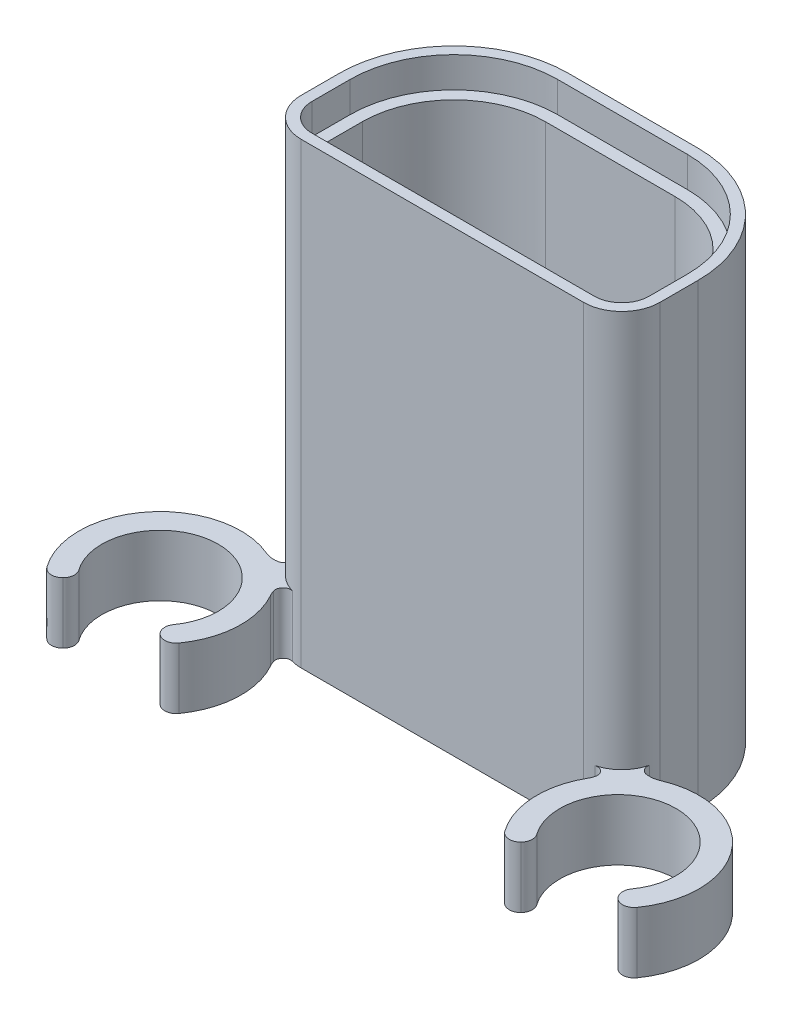
from build123d import *

# Parameters (mm, degrees)
SKETCH1_W               = 47
SKETCH1_H               = 25
BOSS_EXTRUDE1_DEPTH     = 60
SHELL1_T                = -3
FILLET2_R               = 12
FILLET3_R               = 15
SKETCH5_R               = 7.624999999999999
BOSS_EXTRUDE3_DEPTH     = 8
FILLET7_R               = 2
FILLET8_R               = 5
FILLET9_R               = 3
FILLET10_R              = 3
FILLET11_R              = 1
CUT_EXTRUDE5_DEPTH      = 4
CUT_EXTRUDE6_DEPTH      = 70
CUT_EXTRUDE6_DEPTH_BACK = 1
SKETCH8_R               = 5.499999999999999
CUT_EXTRUDE7_DEPTH      = 0.5
BOSS_EXTRUDE4_DEPTH     = 0.5
CIRPATTERN1_COUNT       = 18
SKETCH11_R              = 7.086373105198711
SKETCH11_R_2            = 6.555925452129436
BOSS_EXTRUDE5_DEPTH     = 0.5
FILLET12_R              = 0.5
CUT_EXTRUDE8_DEPTH      = 10
FILLET13_R              = 1.5


# Some blends are built 0.0001 mm under size
with BuildPart() as part:
    # Sketch1 → Boss-Extrude1 (new body)
    with BuildSketch(Plane(origin=(0, 0, 0), x_dir=(1, 0, 0), z_dir=(0, 1, 0))):
        Rectangle(SKETCH1_W, SKETCH1_H)
    extrude(amount=BOSS_EXTRUDE1_DEPTH)

    # Shell1
    shell1_openings = [part.faces().sort_by_distance(p)[0] for p in [
        (0, 60, 0),
    ]]
    offset(amount=SHELL1_T, openings=shell1_openings, kind=Kind.INTERSECTION)

    # Fillet2
    fillet2_edges = [part.edges().sort_by_distance(p)[0] for p in [
        (-20.500000000000007, 31.5, -9.499999999999996),
        (20.499999999999993, 31.5, -9.499999999999996),
    ]]
    fillet(fillet2_edges, radius=FILLET2_R)

    # Fillet3
    fillet3_edges = [part.edges().sort_by_distance(p)[0] for p in [
        (-23.500000000000007, 30, -12.499999999999996),
        (23.499999999999993, 30, -12.499999999999996),
    ]]
    fillet(fillet3_edges, radius=FILLET3_R)

    # Sketch5 → Boss-Extrude3 (add)
    # profile 1 of 2: a face of its own
    with BuildSketch(Plane(origin=(0, 0, 0), x_dir=(1, 0, 0), z_dir=(0, 1, 0))):
        with BuildLine():
            Line((-24.109061311975577, -10.657632309503462), (-23.023781021816077, -9.500000000000002))
            Line((-23.023781021816077, -9.500000000000002), (-18.81711504197636, -9.500000000000002))
            Line((-18.81711504197636, -9.500000000000002), (-21.851077989353325, -12.681958120955978))
            ThreePointArc((-21.851077989353325, -12.681958120955978), (-37.092523941253255, -27.41117748143407), (-24.109061311975577, -10.657632309503462))
        make_face()
        with Locations(Location((-30, -19.500000000000004, 0), (0, 0, 270))):
            Circle(SKETCH5_R, mode=Mode.SUBTRACT)
    # profile 2 of 2: a face of its own
    with BuildSketch(Plane(origin=(0, 0, 0), x_dir=(1, 0, 0), z_dir=(0, 1, 0))):
        with BuildLine():
            Line((21.851077989353325, -12.681958120955972), (18.81711504197636, -9.499999999999996))
            Line((18.81711504197636, -9.499999999999996), (23.023781021816077, -9.499999999999996))
            Line((23.023781021816077, -9.499999999999996), (24.109061311975577, -10.657632309503457))
            ThreePointArc((24.109061311975577, -10.657632309503457), (37.092523941253255, -27.411177481434063), (21.851077989353325, -12.681958120955972))
        make_face()
        with Locations(Location((30, -19.499999999999996, 0), (0, 0, 90))):
            Circle(SKETCH5_R, mode=Mode.SUBTRACT)
    extrude(amount=BOSS_EXTRUDE3_DEPTH)

    # Fillet7
    fillet7_edges = [part.edges().sort_by_distance(p)[0] for p in [
        (-20.500000000000007, 31.5, 9.5),
        (20.499999999999993, 31.5, 9.5),
    ]]
    fillet(fillet7_edges, radius=FILLET7_R)

    # Fillet8
    # the kernel refuses this fillet: 5 mm, written as the material it takes off along each edge
    with BuildSketch(Plane(origin=(-23.500000000000007, -4.499999999999998, 12.5), x_dir=(0, 0, -1), z_dir=(0, 1, 0))) as fillet8_piece_1_section:
        with BuildLine():
            CenterArc((FILLET8_R, -FILLET8_R), FILLET8_R, 90, 89.99999999999997)
            Line((0, -FILLET8_R), (0, 0))
            Line((0, 0), (FILLET8_R, 0))
        make_face()
    fillet8_piece_1 = extrude(amount=77, mode=Mode.PRIVATE)
    fillet8_piece_1 = split(fillet8_piece_1, bisect_by=Plane(origin=(-23.438804598936287, 8, 9.039032547374688), z_dir=(0, -1, 0)), keep=Keep.TOP, mode=Mode.PRIVATE)
    fillet8_piece_1 = split(fillet8_piece_1, bisect_by=Plane(origin=(-22.987914319574855, 1.7499999999999993, 9.461742184276032), z_dir=(-0.7295372041400837, 0, -0.6839411288813314)), keep=Keep.TOP, mode=Mode.PRIVATE)
    add(fillet8_piece_1, mode=Mode.SUBTRACT)
    with BuildSketch(Plane(origin=(-23.500000000000007, 8, 12.5), x_dir=(0, 0, -1), z_dir=(0, 1, 0))) as fillet8_piece_2_section:
        with BuildLine():
            CenterArc((FILLET8_R, -FILLET8_R), FILLET8_R, 90, 89.99999999999997)
            Line((0, -FILLET8_R), (0, 0))
            Line((0, 0), (FILLET8_R, 0))
        make_face()
    fillet8_piece_2 = extrude(amount=64.5, mode=Mode.PRIVATE)
    fillet8_piece_2 = split(fillet8_piece_2, bisect_by=Plane(origin=(-22.987914319574855, 40.25000000000001, 9.461742184276032), z_dir=(-0.7295372041400837, 0, -0.6839411288813314)), keep=Keep.TOP, mode=Mode.PRIVATE)
    add(fillet8_piece_2, mode=Mode.SUBTRACT)
    with BuildSketch(Plane(origin=(-23.500000000000007, -4.499999999999998, 12.5), x_dir=(0, 0, -1), z_dir=(0, 1, 0))) as fillet8_piece_3_section:
        with BuildLine():
            CenterArc((FILLET8_R, -FILLET8_R), FILLET8_R, 90, 89.99999999999997)
            Line((0, -FILLET8_R), (0, 0))
            Line((0, 0), (FILLET8_R, 0))
        make_face()
    fillet8_piece_3 = extrude(amount=77, mode=Mode.PRIVATE)
    fillet8_piece_3 = split(fillet8_piece_3, bisect_by=Plane(origin=(-20.487794777660064, 8, 12.365998214829558), z_dir=(0, -1, 0)), keep=Keep.TOP, mode=Mode.PRIVATE)
    fillet8_piece_3 = split(fillet8_piece_3, bisect_by=Plane(origin=(-21.044075525816314, 1.7500000000000062, 11.835590486603977), z_dir=(0.7237372179730626, 0, 0.6900756765171571)), keep=Keep.TOP, mode=Mode.PRIVATE)
    add(fillet8_piece_3, mode=Mode.SUBTRACT)
    with BuildSketch(Plane(origin=(-23.500000000000007, 8, 12.5), x_dir=(0, 0, -1), z_dir=(0, 1, 0))) as fillet8_piece_4_section:
        with BuildLine():
            CenterArc((FILLET8_R, -FILLET8_R), FILLET8_R, 90, 89.99999999999997)
            Line((0, -FILLET8_R), (0, 0))
            Line((0, 0), (FILLET8_R, 0))
        make_face()
    fillet8_piece_4 = extrude(amount=64.5, mode=Mode.PRIVATE)
    fillet8_piece_4 = split(fillet8_piece_4, bisect_by=Plane(origin=(-23.833277764377865, 40.2499999999999, 10.363463192065906), z_dir=(0.7295372041400837, 0, 0.6839411288813314)), keep=Keep.TOP, mode=Mode.PRIVATE)
    fillet8_piece_4 = split(fillet8_piece_4, bisect_by=Plane(origin=(-21.62776506078224, 40.2499999999999, 12.44775210100588), z_dir=(-0.7237372179730626, 0, -0.6900756765171571)), keep=Keep.TOP, mode=Mode.PRIVATE)
    add(fillet8_piece_4, mode=Mode.SUBTRACT)
    with BuildSketch(Plane(origin=(-23.500000000000007, 8, 12.5), x_dir=(0, 0, -1), z_dir=(0, 1, 0))) as fillet8_piece_5_section:
        with BuildLine():
            CenterArc((FILLET8_R, -FILLET8_R), FILLET8_R, 90, 89.99999999999997)
            Line((0, -FILLET8_R), (0, 0))
            Line((0, 0), (FILLET8_R, 0))
        make_face()
    fillet8_piece_5 = extrude(amount=64.5, mode=Mode.PRIVATE)
    fillet8_piece_5 = split(fillet8_piece_5, bisect_by=Plane(origin=(-21.044075525816314, 40.24999999999998, 11.835590486603977), z_dir=(0.7237372179730626, 0, 0.6900756765171571)), keep=Keep.TOP, mode=Mode.PRIVATE)
    add(fillet8_piece_5, mode=Mode.SUBTRACT)
    with BuildSketch(Plane(origin=(23.49999999999999, -4.5, 12.5), x_dir=(0, 0, -1), z_dir=(0, 1, 0))) as fillet8_piece_6_section:
        with BuildLine():
            CenterArc((FILLET8_R, FILLET8_R), FILLET8_R, 180, 90)
            Line((0, FILLET8_R), (0, 0))
            Line((0, 0), (FILLET8_R, 0))
        make_face()
    fillet8_piece_6 = extrude(amount=77, mode=Mode.PRIVATE)
    fillet8_piece_6 = split(fillet8_piece_6, bisect_by=Plane(origin=(22.98791431957484, 1.7500000000000275, 9.461742184276012), z_dir=(0.7295372041400837, 0, -0.6839411288813314)), keep=Keep.TOP, mode=Mode.PRIVATE)
    fillet8_piece_6 = split(fillet8_piece_6, bisect_by=Plane(origin=(23.43880459893627, 8, 9.03903254737467), z_dir=(0, -1, 0)), keep=Keep.TOP, mode=Mode.PRIVATE)
    add(fillet8_piece_6, mode=Mode.SUBTRACT)
    with BuildSketch(Plane(origin=(23.49999999999999, 8, 12.5), x_dir=(0, 0, -1), z_dir=(0, 1, 0))) as fillet8_piece_7_section:
        with BuildLine():
            CenterArc((FILLET8_R, FILLET8_R), FILLET8_R, 180, 90)
            Line((0, FILLET8_R), (0, 0))
            Line((0, 0), (FILLET8_R, 0))
        make_face()
    fillet8_piece_7 = extrude(amount=64.5, mode=Mode.PRIVATE)
    fillet8_piece_7 = split(fillet8_piece_7, bisect_by=Plane(origin=(22.987914319574845, 40.249999999999865, 9.461742184276018), z_dir=(0.7295372041400837, 0, -0.6839411288813314)), keep=Keep.TOP, mode=Mode.PRIVATE)
    add(fillet8_piece_7, mode=Mode.SUBTRACT)
    with BuildSketch(Plane(origin=(23.49999999999999, -4.5, 12.5), x_dir=(0, 0, -1), z_dir=(0, 1, 0))) as fillet8_piece_8_section:
        with BuildLine():
            CenterArc((FILLET8_R, FILLET8_R), FILLET8_R, 180, 90)
            Line((0, FILLET8_R), (0, 0))
            Line((0, 0), (FILLET8_R, 0))
        make_face()
    fillet8_piece_8 = extrude(amount=77, mode=Mode.PRIVATE)
    fillet8_piece_8 = split(fillet8_piece_8, bisect_by=Plane(origin=(20.487794777660056, 8, 12.365998214829556), z_dir=(0, -1, 0)), keep=Keep.TOP, mode=Mode.PRIVATE)
    fillet8_piece_8 = split(fillet8_piece_8, bisect_by=Plane(origin=(21.04407552581631, 1.7499999999999931, 11.835590486603968), z_dir=(-0.7237372179730626, 0, 0.6900756765171571)), keep=Keep.TOP, mode=Mode.PRIVATE)
    add(fillet8_piece_8, mode=Mode.SUBTRACT)
    with BuildSketch(Plane(origin=(23.49999999999999, 8, 12.5), x_dir=(0, 0, -1), z_dir=(0, 1, 0))) as fillet8_piece_9_section:
        with BuildLine():
            CenterArc((FILLET8_R, FILLET8_R), FILLET8_R, 180, 90)
            Line((0, FILLET8_R), (0, 0))
            Line((0, 0), (FILLET8_R, 0))
        make_face()
    fillet8_piece_9 = extrude(amount=64.5, mode=Mode.PRIVATE)
    fillet8_piece_9 = split(fillet8_piece_9, bisect_by=Plane(origin=(23.833277764377858, 40.250000000000014, 10.363463192065893), z_dir=(-0.7295372041400837, 0, 0.6839411288813314)), keep=Keep.TOP, mode=Mode.PRIVATE)
    fillet8_piece_9 = split(fillet8_piece_9, bisect_by=Plane(origin=(21.627765060782234, 40.250000000000014, 12.44775210100587), z_dir=(0.7237372179730626, 0, -0.6900756765171571)), keep=Keep.TOP, mode=Mode.PRIVATE)
    add(fillet8_piece_9, mode=Mode.SUBTRACT)
    with BuildSketch(Plane(origin=(23.49999999999999, 8, 12.5), x_dir=(0, 0, -1), z_dir=(0, 1, 0))) as fillet8_piece_10_section:
        with BuildLine():
            CenterArc((FILLET8_R, FILLET8_R), FILLET8_R, 180, 90)
            Line((0, FILLET8_R), (0, 0))
            Line((0, 0), (FILLET8_R, 0))
        make_face()
    fillet8_piece_10 = extrude(amount=64.5, mode=Mode.PRIVATE)
    fillet8_piece_10 = split(fillet8_piece_10, bisect_by=Plane(origin=(21.044075525816314, 40.250000000000036, 11.83559048660397), z_dir=(-0.7237372179730626, 0, 0.6900756765171571)), keep=Keep.TOP, mode=Mode.PRIVATE)
    add(fillet8_piece_10, mode=Mode.SUBTRACT)

    # Fillet9
    # the kernel refuses this fillet: 3 mm, written as the material it adds along each edge
    with BuildSketch(Plane(origin=(-24.10906131197558, 0, 10.657632309503459), x_dir=(0.6839411288812834, 0, -0.7295372041401286), z_dir=(0, 1, 0))) as fillet9_piece_1:
        with BuildLine():
            CenterArc((2.330398425193465, 2.8908079117401275), FILLET9_R, 199.9140279839993, 54.580009405858846)
            Line((-0.4902158613140944, 1.8689786467699698), (-0.5466281470442454, 1.848542061470567))
            ThreePointArc((-0.5466281470442454, 1.848542061470567), (-0.2605714309807761, 0.9304333898711258), (-0.05918056353521951, -0.00988235294117272))
            Line((-0.05918056353521951, -0.00988235294117272), (6.72e-15, -0.05999999999999864))
            ThreePointArc((6.72e-15, -0.05999999999999864), (0.7641912271959885, -0.06000000000008859), (1.5123421349759287, -0.05781615823480298))
            Line((1.5123421349759287, -0.05781615823480298), (1.528382454391958, 5e-17))
        make_face()
    extrude(amount=8)
    with BuildSketch(Plane(origin=(24.109061311975577, 0, 10.657632309503459), x_dir=(0.8791890960981853, 0, -0.4764730142432579), z_dir=(0, 1, 0))) as fillet9_piece_2:
        with BuildLine():
            CenterArc((2.204979975395922, 2.9875726787521892), FILLET9_R, 210.203051106146, 54.58000940585879)
            Line((-0.3877640665635849, 1.4783747683098676), (-0.43961894740277574, 1.4481908101010217))
            ThreePointArc((-0.43961894740277574, 1.4481908101010217), (-0.25191887206113933, 0.7239648566213424), (-0.0580368387792579, -0.01522252753356888))
            Line((-0.0580368387792579, -0.01522252753356888), (0.00545562055768073, -0.05975145357504427))
            ThreePointArc((0.00545562055768073, -0.05975145357504427), (0.9660994737559414, -0.01598657058067033), (1.9267433269542062, -0.05975145357504364))
            Line((1.9267433269542062, -0.05975145357504364), (1.9321989475118866, -4e-17))
        make_face()
    extrude(amount=8)

    # Fillet10
    # the kernel refuses this fillet: 3 mm, written as the material it adds along each edge
    with BuildSketch(Plane(origin=(-21.85107798935332, 0, 12.681958120955976), x_dir=(0.5712001506063948, 0, 0.8208108113001631), z_dir=(0, 1, 0))) as fillet10_piece_1:
        with BuildLine():
            CenterArc((2.149193638263051, 2.98819477692178), FILLET10_R, 217.23553231937467, 47.67986970857078)
            Line((-0.23927081913074655, 1.172915862879494), (-0.2870401082786234, 1.136610284598648))
            ThreePointArc((-0.2870401082786234, 1.136610284598648), (-0.17842463259395833, 0.5744651312779336), (-0.05878922302837329, -0.0119928001617703))
            Line((-0.05878922302837329, -0.0119928001617703), (0.00531759250704288, -0.05976389553843487))
            ThreePointArc((0.00531759250704288, -0.05976389553843487), (0.9416570064554589, -0.01818983493130785), (1.8779964204038802, -0.05976389553843735))
            Line((1.8779964204038802, -0.05976389553843735), (1.8833140129109234, -1e-16))
        make_face()
    extrude(amount=8)
    with BuildSketch(Plane(origin=(21.85107798935332, 0, 12.681958120955974), x_dir=(-0.6900756765174183, 0, -0.7237372179728133), z_dir=(0, 1, 0))) as fillet10_piece_2:
        with BuildLine():
            CenterArc((2.4983133230015917, 2.7031041155837388), FILLET10_R, 196.6145399789958, 47.67986970857072)
            Line((-0.376436809977725, 1.8453094589581573), (-0.43393181263731273, 1.8281535658256447))
            ThreePointArc((-0.43393181263731273, 1.8281535658256447), (-0.20604117603262675, 0.9190189452239744), (-0.05962076346887163, -0.00673532207015936))
            Line((-0.05962076346887163, -0.00673532207015936), (-2.607e-14, -0.05999999999999991))
            ThreePointArc((-2.607e-14, -0.05999999999999991), (0.598536161455952, -0.05999999999993272), (1.1710475029101708, -0.05406208231167564))
            Line((1.1710475029101708, -0.05406208231167564), (1.197072322911963, 2e-17))
        make_face()
    extrude(amount=8)

    # Fillet11
    fillet11_edges = [part.edges().sort_by_distance(p)[0] for p in [
        (-21.025007496279773, 4, 11.815592328259351),
        (-23.0637376907564, 4, 9.542620446869517),
        (23.0637376907564, 4, 9.542620446869517),
        (21.025007496279773, 4, 11.815592328259351),
    ]]
    fillet(fillet11_edges, radius=FILLET11_R)

    # Sketch6 → Cut-Extrude5 (cut)
    with BuildSketch(Plane(origin=(0, 60, 0), x_dir=(1, 0, 0), z_dir=(0, 1, 0))):
        with BuildLine():
            Line((22.09999999999999, -7.500000000000001), (22.099999999999994, -2.5000000000000004))
            ThreePointArc((22.099999999999994, -2.5000000000000004), (18.11665222413704, 7.116652224137045), (8.499999999999993, 11.099999999999998))
            Line((8.499999999999993, 11.099999999999998), (-8.500000000000007, 11.099999999999998))
            ThreePointArc((-8.500000000000007, 11.099999999999998), (-18.116652224137056, 7.116652224137045), (-22.10000000000001, -2.500000000000001))
            Line((-22.10000000000001, -2.500000000000001), (-22.10000000000001, -7.500000000000002))
            ThreePointArc((-22.10000000000001, -7.500000000000002), (-21.04558441227158, -10.045584412271571), (-18.50000000000001, -11.1))
            Line((-18.50000000000001, -11.1), (18.49999999999999, -11.100000000000001))
            ThreePointArc((18.49999999999999, -11.100000000000001), (21.04558441227156, -10.045584412271573), (22.09999999999999, -7.500000000000001))
        make_face()
    extrude(amount=-CUT_EXTRUDE5_DEPTH, mode=Mode.SUBTRACT)

    # Sketch7 → Cut-Extrude6 (cut, two sides: drawn at the far end of the back side and taken through both)
    with BuildSketch(Plane(origin=(0, 3, 0), x_dir=(1, 0, 0), z_dir=(0, 1, 0)).offset(-CUT_EXTRUDE6_DEPTH_BACK)):
        with BuildLine():
            Line((-20.500000000000007, -8.000000000000002), (20.49999999999999, -8.000000000000002))
            Line((20.49999999999999, -8.000000000000002), (20.49999999999999, -3.0000000000000018))
            Line((20.49999999999999, -3.0000000000000018), (15.500000000000005, -3.0000000000000018))
            ThreePointArc((15.500000000000005, -3.0000000000000018), (14.085786437626895, -2.4142135623730967), (13.499999999999991, -0.9999999999999875))
            Line((13.499999999999991, -0.9999999999999875), (13.499999999999991, 4.999999999999984))
            ThreePointArc((13.499999999999991, 4.999999999999984), (12.914213562373087, 6.414213562373093), (11.499999999999977, 6.999999999999998))
            Line((11.499999999999977, 6.999999999999998), (-11.499999999999995, 6.999999999999998))
            ThreePointArc((-11.499999999999995, 6.999999999999998), (-12.914213562373105, 6.414213562373093), (-13.500000000000009, 4.999999999999984))
            Line((-13.500000000000009, 4.999999999999984), (-13.500000000000009, -0.9999999999999875))
            ThreePointArc((-13.500000000000009, -0.9999999999999875), (-14.085786437626913, -2.4142135623730967), (-15.500000000000023, -3.0000000000000018))
            Line((-15.500000000000023, -3.0000000000000018), (-20.500000000000007, -3.0000000000000018))
            Line((-20.500000000000007, -3.0000000000000018), (-20.500000000000007, -8.000000000000002))
        make_face()
    extrude(amount=CUT_EXTRUDE6_DEPTH + CUT_EXTRUDE6_DEPTH_BACK, mode=Mode.SUBTRACT)

    # Sketch8 → Cut-Extrude7 (cut)
    with BuildSketch(Plane(origin=(0, 0, -12.499999999999996), x_dir=(-1, 0, 0), z_dir=(0, 0, -1))):
        with BuildLine():
            Line((-6.999999999999999, 24), (7.000000000000003, 24))
            ThreePointArc((7.000000000000003, 24), (9.121320343559645, 24.878679656440358), (10.000000000000002, 27))
            Line((10.000000000000002, 27), (10.000000000000002, 41))
            ThreePointArc((10.000000000000002, 41), (9.121320343559649, 43.121320343559645), (7.000000000000002, 44.00000000000001))
            Line((7.000000000000002, 44.00000000000001), (-6.999999999999999, 44.00000000000001))
            ThreePointArc((-6.999999999999999, 44.00000000000001), (-9.121320343559642, 43.121320343559645), (-9.999999999999998, 41))
            Line((-9.999999999999998, 41), (-9.999999999999996, 27))
            ThreePointArc((-9.999999999999996, 27), (-9.121320343559642, 24.878679656440358), (-6.999999999999999, 24))
        make_face()
        with Locations((0, 34)):
            Circle(SKETCH8_R, mode=Mode.SUBTRACT)
    extrude(amount=-CUT_EXTRUDE7_DEPTH, mode=Mode.SUBTRACT)

    # Sketch10 → Boss-Extrude4 (add)
    with BuildSketch(Plane(origin=(0, 0, -11.999999999999996), x_dir=(-1, 0, 0), z_dir=(0, 0, -1))):
        with BuildLine():
            Line((0.5710432913647049, 42.130448263961284), (-0.5710432913647049, 42.130448263961284))
            Line((-0.5710432913647049, 42.130448263961284), (-0.8629869867694857, 40.64418945099148))
            ThreePointArc((-0.8629869867694857, 40.64418945099148), (4.1e-16, 40.699999999999996), (0.8629869867694857, 40.64418945099148))
            Line((0.8629869867694857, 40.64418945099148), (0.5710432913647049, 42.130448263961284))
        make_face()
    boss_extrude4 = extrude(amount=BOSS_EXTRUDE4_DEPTH)

    # CirPattern1: Boss-Extrude4 ×18 about axis
    cirpattern1_axis = Axis((9.3e-15, 34.000000000000014, 0), (0, 0, 1))
    for i in range(1, CIRPATTERN1_COUNT):
        add(boss_extrude4.rotate(cirpattern1_axis, i * 360 / CIRPATTERN1_COUNT))

    # Sketch11 → Boss-Extrude5 (add)
    with BuildSketch(Plane(origin=(0, 0, -11.999999999999996), x_dir=(-1, 0, 0), z_dir=(0, 0, -1))):
        with Locations((0, 34)):
            Circle(SKETCH11_R)
        with Locations((0, 34)):
            Circle(SKETCH11_R_2, mode=Mode.SUBTRACT)
    extrude(amount=BOSS_EXTRUDE5_DEPTH)

    # Fillet12
    fillet12_edges = [part.edges().sort_by_distance(p)[0] for p in [
        (5.499999999999999, 34, -11.999999999999996),
        (6.555925452129436, 34, -11.999999999999996),
        (6.909139828891078, 30.793739058628848, -11.999999999999996),
        (7.041174740745561, 29.934775868019383, -11.999999999999996),
        (6.231273340834811, 29.619639860567066, -11.999999999999996),
        (5.4284767391052196, 29.444967170362304, -11.999999999999996),
        (5.395861886479732, 28.624035258544986, -11.999999999999996),
        (5.226151405271757, 27.771715287326145, -11.999999999999996),
        (4.357310173775517, 27.752586899456418, -11.999999999999996),
        (3.54318655259932, 27.86302087020308, -11.999999999999996),
        (3.2317633661187433, 27.102752147070206, -11.999999999999996),
        (2.780777080541986, 26.359877762674017, -11.999999999999996),
        (1.9577910927096767, 26.639064160268823, -11.999999999999996),
        (1.2305357759857645, 27.021284825263123, -11.999999999999996),
        (0.677866488056292, 26.41337891919583, -11.999999999999996),
        (1.76e-14, 25.869551736038744, -11.999999999999996),
        (-0.6778664880562565, 26.41337891919583, -11.999999999999996),
        (-1.2305357759857247, 27.021284825263116, -11.999999999999996),
        (-1.957791092709643, 26.63906416026881, -11.999999999999996),
        (-2.7807770805419523, 26.359877762674003, -11.999999999999996),
        (-3.2317633661187095, 27.10275214707019, -11.999999999999996),
        (-3.543186552599285, 27.86302087020306, -11.999999999999996),
        (-4.357310173775492, 27.752586899456396, -11.999999999999996),
        (-5.226151405271722, 27.77171528732613, -11.999999999999996),
        (-5.395861886479704, 28.624035258544968, -11.999999999999996),
        (-5.42847673910514, 29.44496717036221, -11.999999999999996),
        (-6.231273340834736, 29.619639860567073, -11.999999999999996),
        (-7.041174740745536, 29.934775868019376, -11.999999999999996),
        (-6.90913982889106, 30.79373905862883, -11.999999999999996),
        (-6.65901251509099, 31.576317654900876, -11.999999999999996),
        (-7.353652979189349, 32.015028901723866, -11.999999999999996),
        (-8.006928485813702, 32.58816247534787, -11.999999999999996),
        (-7.589073539894244, 33.35016524761382, -11.999999999999996),
        (-7.086373105198711, 34.00000000000001, -11.999999999999996),
        (-7.589073539894244, 34.649834752386184, -11.999999999999996),
        (-8.006928485813702, 35.41183752465214, -11.999999999999996),
        (-7.353652979189349, 35.98497109827615, -11.999999999999996),
        (-6.659012515090988, 36.42368234509913, -11.999999999999996),
        (-6.909139828891057, 37.206260941371184, -11.999999999999996),
        (-7.041174740745539, 38.06522413198064, -11.999999999999996),
        (-6.23127334083474, 38.38036013943294, -11.999999999999996),
        (-5.428476739105138, 38.555032829637796, -11.999999999999996),
        (-5.395861886479711, 39.375964741455036, -11.999999999999996),
        (-5.226151405271736, 40.228284712673876, -11.999999999999996),
        (-4.357310173775495, 40.24741310054362, -11.999999999999996),
        (-3.543186552599291, 40.13697912979694, -11.999999999999996),
        (-3.2317633661187255, 40.89724785292982, -11.999999999999996),
        (-2.7807770805419683, 41.64012223732601, -11.999999999999996),
        (-1.95779109270965, 41.3609358397312, -11.999999999999996),
        (-1.2305357759857374, 40.97871517473688, -11.999999999999996),
        (-0.6778664880562775, 41.586621080804186, -11.999999999999996),
        (0, 42.130448263961284, -11.999999999999996),
        (0.6778664880562775, 41.586621080804186, -11.999999999999996),
        (1.2305357759857365, 40.97871517473688, -11.999999999999996),
        (1.95779109270965, 41.3609358397312, -11.999999999999996),
        (2.7807770805419665, 41.640122237326025, -11.999999999999996),
        (3.231763366118722, 40.89724785292982, -11.999999999999996),
        (3.5431865525992885, 40.13697912979694, -11.999999999999996),
        (4.357310173775499, 40.24741310054362, -11.999999999999996),
        (5.226151405271743, 40.22828471267389, -11.999999999999996),
        (5.3958618864797145, 39.37596474145504, -11.999999999999996),
        (5.428476739105135, 38.555032829637796, -11.999999999999996),
        (6.231273340834747, 38.38036013943295, -11.999999999999996),
        (7.041174740745554, 38.065224131980656, -11.999999999999996),
        (6.909139828891064, 37.206260941371184, -11.999999999999996),
        (6.659012515090984, 36.423682345099145, -11.999999999999996),
        (7.353652979189356, 35.98497109827616, -11.999999999999996),
        (8.00692848581371, 35.41183752465215, -11.999999999999996),
        (7.589073539894258, 34.6498347523862, -11.999999999999996),
        (7.086373105198711, 34.00000000000003, -11.999999999999996),
        (7.589073539894251, 33.350165247613845, -11.999999999999996),
        (8.006928485813717, 32.58816247534789, -11.999999999999996),
        (7.353652979189356, 32.01502890172389, -11.999999999999996),
        (6.659012515090999, 31.5763176549009, -11.999999999999996),
        (-1.78e-15, 44.00000000000001, -11.999999999999996),
        (-9.121320343559645, 43.121320343559645, -11.999999999999996),
        (-9.121320343559645, 24.878679656440358, -11.999999999999996),
        (-1.78e-15, 24, -11.999999999999996),
        (9.121320343559642, 24.878679656440355, -11.999999999999996),
        (9.121320343559642, 43.121320343559645, -11.999999999999996),
    ]]
    fillet(fillet12_edges, radius=FILLET12_R - 0.0001)  # a hair under: the kernel refuses the full size

    # Sketch12 → Cut-Extrude8 (cut)
    with BuildSketch(Plane.XZ):
        Polygon((-30, 19.500000000000004), (-43.93780553969151, 33.43780553969146), (-16.062194460308515, 33.43780553969149), align=None)
        Polygon((43.93780553969151, 33.43780553969146), (16.062194460308515, 33.43780553969149), (30, 19.500000000000004), align=None)
    extrude(amount=-CUT_EXTRUDE8_DEPTH, mode=Mode.SUBTRACT)

    # Fillet13
    fillet13_edges = [part.edges().sort_by_distance(p)[0] for p in [
        (37.51300955010708, 4, 27.013009550107057),
        (35.39168920654743, 4, 24.89168920654741),
        (24.608310793452578, 4, 24.891689206547426),
        (22.48699044989292, 4, 27.01300955010708),
        (-22.48699044989293, 4, 27.013009550107075),
        (-24.608310793452574, 4, 24.89168920654743),
        (-35.39168920654743, 4, 24.89168920654742),
        (-37.513009550107085, 4, 27.013009550107057),
    ]]
    fillet(fillet13_edges, radius=FILLET13_R - 0.0001)  # a hair under: the kernel refuses the full size


solid = part.part
